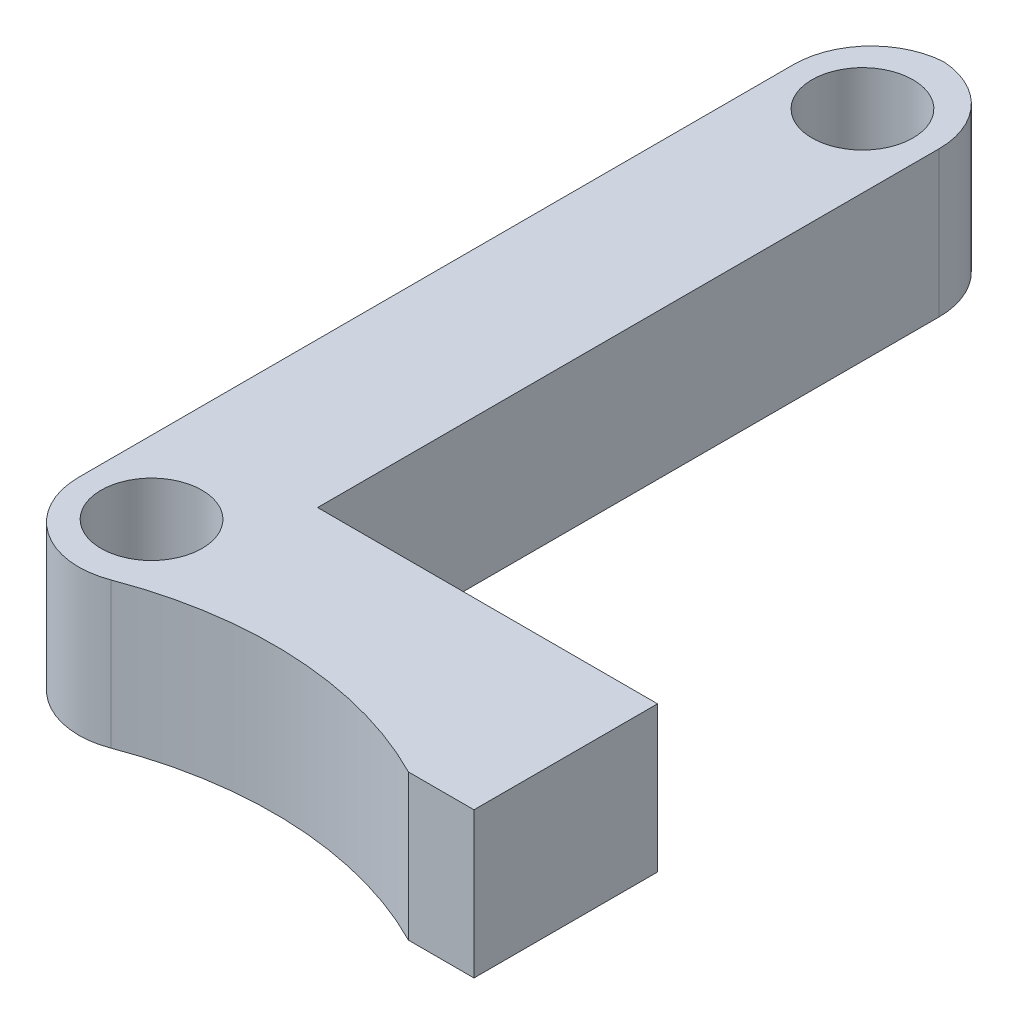
from build123d import *

# Parameters (mm, degrees)
SKETCH1_R           = 3.302
BOSS_EXTRUDE1_DEPTH = 9.525
FILLET1_R           = 5.08
FILLET2_R           = 5.08
FILLET3_DEPTH       = 9.525


with BuildPart() as part:
    # Sketch1 → Boss-Extrude1 (new body)
    with BuildSketch(Plane(origin=(0, 0, 0), x_dir=(1, 0, 0), z_dir=(0, 1, 0))):
        with BuildLine():
            Line((-4.7625, 28.575), (4.7625, 28.575))
            Line((4.7625, 28.575), (4.7625, -17.145))
            Line((4.7625, -17.145), (26.9875, -17.145))
            Line((26.9875, -17.145), (26.9875, -29.1465))
            Line((26.9875, -29.1465), (22.703516651, -29.1465))
            ThreePointArc((22.703516651, -29.1465), (11.1125, -26.347569289), (-0.478516651, -29.1465))
            Line((-0.478516651, -29.1465), (-4.7625, -29.1465))
            Line((-4.7625, -29.1465), (-4.7625, 28.575))
        make_face()
        with Locations(Location((0, -23.241, 0), (0, 0, 90))):
            Circle(SKETCH1_R, mode=Mode.SUBTRACT)
        with Locations(Location((0, 23.241, 0), (0, 0, 90))):
            Circle(SKETCH1_R, mode=Mode.SUBTRACT)
    extrude(amount=BOSS_EXTRUDE1_DEPTH)

    # Fillet1
    # the kernel refuses this fillet: 5.08 mm, written as the material it takes off along each edge
    with BuildSketch(Plane(origin=(-4.7625, -12.7, -28.575), x_dir=(0, 0, 1), z_dir=(0, 1, 0)), Plane(origin=(4.7625, -12.7, -28.575), x_dir=(-1, 0, 0), z_dir=(0, 1, 0))) as fillet1_piece_1:
        with BuildLine():
            CenterArc((FILLET1_R, FILLET1_R), FILLET1_R, 180, 90)
            Line((0, FILLET1_R), (0, 0))
            Line((0, 0), (FILLET1_R, 0))
        make_face()
    extrude(amount=34.925, mode=Mode.SUBTRACT)

    # Fillet2
    # the kernel refuses this fillet: 5.08 mm, written as the material it takes off along each edge
    with BuildSketch(Plane(origin=(-4.7625, -12.543115017, 29.1465), x_dir=(1, 0, 0), z_dir=(0, 1, 0))) as fillet2_piece_1:
        with BuildLine():
            CenterArc((5.08, 5.017246007), FILLET2_R, 180, 80.98481696)
            Line((0, 5.017246007), (-0.1016, 5.017246007))
            Line((-0.1016, 5.017246007), (-0.1016, 0))
            Line((-0.1016, 0), (0, -0.1016))
            ThreePointArc((0, -0.1016), (2.141991675, -0.1016), (4.268063016, -0.10034492))
            Line((4.268063016, -0.10034492), (4.283983349, 0))
        make_face()
    extrude(amount=34.611230034, mode=Mode.SUBTRACT)

    # Fillet3: read off the stored shape, not the designer's step
    # Fillet3 outline → Fillet3 (cut)
    with BuildSketch(Plane(origin=(0, 0, 0), x_dir=(1, 0, 0), z_dir=(0, 1, 0))):
        with BuildLine():
            ThreePointArc((-0.478516651, -29.1465), (0.802955992, -28.533924544), (2.116666667, -27.993938353))
            ThreePointArc((2.116666667, -27.993938353), (-2.569248459, -27.423293904), (-4.7625, -23.243212166))
            Line((-4.7625, -23.243212166), (-4.7625, -24.129253993))
            ThreePointArc((-4.7625, -24.129253993), (-3.545799405, -27.427938232), (-0.478516651, -29.1465))
        make_face()
    extrude(amount=FILLET3_DEPTH, mode=Mode.SUBTRACT)


solid = part.part
